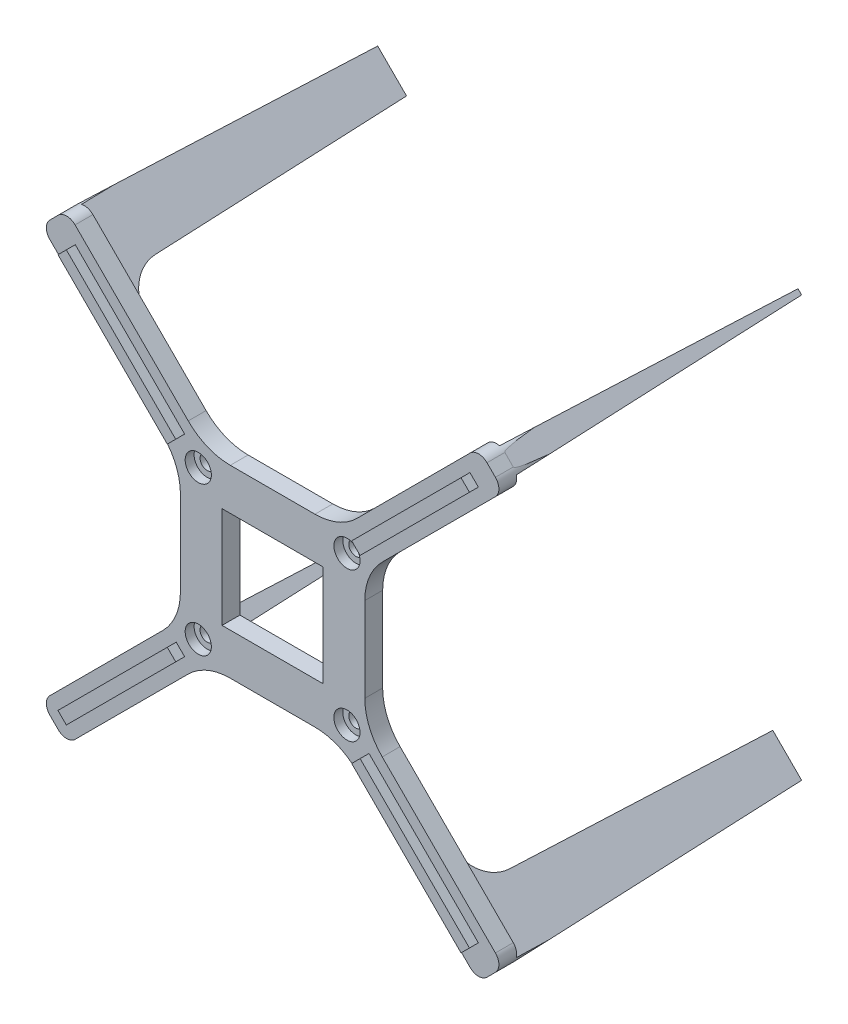
from build123d import *

# Parameters (mm, degrees)
SKETCH2_W                      = 17
SKETCH2_H                      = 17
BOSS_EXTRUDE1_DEPTH            = 3
SKETCH3_R                      = 2.2
CUT_EXTRUDE1_DEPTH             = 1.5
M2_CLEARANCE_HOLE1_D           = 2.4
M2_CLEARANCE_HOLE1_CSINK_D     = 2.45
M2_CLEARANCE_HOLE1_CSINK_ANGLE = 90
BOSS_EXTRUDE2_DEPTH            = 50
BOSS_EXTRUDE2_DRAFT            = 1.8
BOSS_EXTRUDE2_PROFILE_2_DEPTH  = 50
BOSS_EXTRUDE2_PROFILE_2_DRAFT  = 1.8
BOSS_EXTRUDE2_PROFILE_3_DEPTH  = 50
BOSS_EXTRUDE2_PROFILE_3_DRAFT  = 1.8
BOSS_EXTRUDE2_PROFILE_4_DEPTH  = 50
BOSS_EXTRUDE2_PROFILE_4_DRAFT  = 1.8
FILLET1_R                      = 6
FILLET2_R                      = 2
BOSS_EXTRUDE3_DEPTH            = 1.5


with BuildPart() as part:
    # Sketch2 → Boss-Extrude1 (new body)
    with BuildSketch(Plane(origin=(0, 0, 0), x_dir=(0, 1, 0), z_dir=(0, 0, 1))):
        with BuildLine():
            Line((-38.870057685, 34.627416998), (-34.627416998, 38.870057685))
            Line((-34.627416998, 38.870057685), (-14.186291501, 18.428932188))
            ThreePointArc((-14.186291501, 18.428932188), (-10.942058013, 16.261204675), (-7.115223689, 15.5))
            Line((-7.115223689, 15.5), (7.115223689, 15.5))
            ThreePointArc((7.115223689, 15.5), (10.942058013, 16.261204675), (14.186291501, 18.428932188))
            Line((14.186291501, 18.428932188), (34.627416998, 38.870057685))
            Line((34.627416998, 38.870057685), (38.870057685, 34.627416998))
            Line((38.870057685, 34.627416998), (18.428932188, 14.186291501))
            ThreePointArc((18.428932188, 14.186291501), (16.261204675, 10.942058013), (15.5, 7.115223689))
            Line((15.5, 7.115223689), (15.5, -7.115223689))
            ThreePointArc((15.5, -7.115223689), (16.261204675, -10.942058013), (18.428932188, -14.186291501))
            Line((18.428932188, -14.186291501), (38.870057685, -34.627416998))
            Line((38.870057685, -34.627416998), (34.627416998, -38.870057685))
            Line((34.627416998, -38.870057685), (14.186291501, -18.428932188))
            ThreePointArc((14.186291501, -18.428932188), (10.942058013, -16.261204675), (7.115223689, -15.5))
            Line((7.115223689, -15.5), (-7.115223689, -15.5))
            ThreePointArc((-7.115223689, -15.5), (-10.942058013, -16.261204675), (-14.186291501, -18.428932188))
            Line((-14.186291501, -18.428932188), (-34.627416998, -38.870057685))
            Line((-34.627416998, -38.870057685), (-38.870057685, -34.627416998))
            Line((-38.870057685, -34.627416998), (-18.428932188, -14.186291501))
            ThreePointArc((-18.428932188, -14.186291501), (-16.261204675, -10.942058013), (-15.5, -7.115223689))
            Line((-15.5, -7.115223689), (-15.5, 7.115223689))
            ThreePointArc((-15.5, 7.115223689), (-16.261204675, 10.942058013), (-18.428932188, 14.186291501))
            Line((-18.428932188, 14.186291501), (-38.870057685, 34.627416998))
        make_face()
        Rectangle(SKETCH2_W, SKETCH2_H, mode=Mode.SUBTRACT)
    extrude(amount=BOSS_EXTRUDE1_DEPTH)

    # Sketch3 → Cut-Extrude1 (cut)
    with BuildSketch(Plane.XY.offset(3)):
        with Locations((-12.5, 12.5)):
            Circle(SKETCH3_R)
        with Locations((12.5, 12.5)):
            Circle(SKETCH3_R)
        with Locations((12.5, -12.5)):
            Circle(SKETCH3_R)
        with Locations((-12.5, -12.5)):
            Circle(SKETCH3_R)
    extrude(amount=-CUT_EXTRUDE1_DEPTH, mode=Mode.SUBTRACT)

    # M2 Clearance Hole1 (through all)
    with Locations(Plane.XY.offset(3)):
        with Locations((12.5, 12.5), (-12.5, -12.5), (-12.5, 12.5), (12.5, -12.5)):
            CounterSinkHole(M2_CLEARANCE_HOLE1_D / 2, M2_CLEARANCE_HOLE1_CSINK_D / 2, counter_sink_angle=M2_CLEARANCE_HOLE1_CSINK_ANGLE)


with BuildPart() as boss_extrude2_tool:
    # Sketch7 → Boss-Extrude2 (with draft: the straight prism first)
    with BuildSketch(Plane(origin=(0, 0, 0), x_dir=(1, 0, 0), z_dir=(0, 0, -1))):
        Polygon((28.263455967, 31.091883092), (31.091883092, 28.263455967), (38.162950904, 35.334523779), (35.334523779, 38.162950904), align=None)
    extrude(amount=BOSS_EXTRUDE2_DEPTH)
    # Boss-Extrude2: the draft: its side faces are tilted about the plane it starts from
    boss_extrude2_sides = [boss_extrude2_tool.faces().sort_by_distance(p)[0] for p in [
        (29.67766953, -29.67766953, -25),
        (34.627416998, -31.798989873, -25),
        (36.748737342, -36.748737342, -25),
        (31.798989873, -34.627416998, -25),
    ]]
    draft(boss_extrude2_sides, Plane(origin=(0, 0, 0), x_dir=(1, 0, 0), z_dir=(0, 0, -1)), BOSS_EXTRUDE2_DRAFT)


with BuildPart() as part_1:
    add(part.part)

    # Boss-Extrude2: add boss_extrude2_tool
    add(boss_extrude2_tool.part)


with BuildPart() as boss_extrude2_profile_2_tool:
    # Sketch7 → Boss-Extrude2 profile 2 (with draft: the straight prism first)
    with BuildSketch(Plane(origin=(0, 0, 0), x_dir=(1, 0, 0), z_dir=(0, 0, -1))):
        Polygon((31.091883092, -28.263455967), (28.263455967, -31.091883092), (35.334523779, -38.162950904), (38.162950904, -35.334523779), align=None)
    extrude(amount=BOSS_EXTRUDE2_PROFILE_2_DEPTH)
    # Boss-Extrude2 profile 2: the draft: its side faces are tilted about the plane it starts from
    boss_extrude2_profile_2_sides = [boss_extrude2_profile_2_tool.faces().sort_by_distance(p)[0] for p in [
        (29.67766953, 29.67766953, -25),
        (31.798989873, 34.627416998, -25),
        (36.748737342, 36.748737342, -25),
        (34.627416998, 31.798989873, -25),
    ]]
    draft(boss_extrude2_profile_2_sides, Plane(origin=(0, 0, 0), x_dir=(1, 0, 0), z_dir=(0, 0, -1)), BOSS_EXTRUDE2_PROFILE_2_DRAFT)


with BuildPart() as part_2:
    add(part_1.part)

    # Boss-Extrude2 profile 2: add boss_extrude2_profile_2_tool
    add(boss_extrude2_profile_2_tool.part)


with BuildPart() as boss_extrude2_profile_3_tool:
    # Sketch7 → Boss-Extrude2 profile 3 (with draft: the straight prism first)
    with BuildSketch(Plane(origin=(0, 0, 0), x_dir=(1, 0, 0), z_dir=(0, 0, -1))):
        Polygon((-28.263455967, -31.091883092), (-31.091883092, -28.263455967), (-38.162950904, -35.334523779), (-35.334523779, -38.162950904), align=None)
    extrude(amount=BOSS_EXTRUDE2_PROFILE_3_DEPTH)
    # Boss-Extrude2 profile 3: the draft: its side faces are tilted about the plane it starts from
    boss_extrude2_profile_3_sides = [boss_extrude2_profile_3_tool.faces().sort_by_distance(p)[0] for p in [
        (-29.67766953, 29.67766953, -25),
        (-34.627416998, 31.798989873, -25),
        (-36.748737342, 36.748737342, -25),
        (-31.798989873, 34.627416998, -25),
    ]]
    draft(boss_extrude2_profile_3_sides, Plane(origin=(0, 0, 0), x_dir=(1, 0, 0), z_dir=(0, 0, -1)), BOSS_EXTRUDE2_PROFILE_3_DRAFT)


with BuildPart() as part_3:
    add(part_2.part)

    # Boss-Extrude2 profile 3: add boss_extrude2_profile_3_tool
    add(boss_extrude2_profile_3_tool.part)


with BuildPart() as boss_extrude2_profile_4_tool:
    # Sketch7 → Boss-Extrude2 profile 4 (with draft: the straight prism first)
    with BuildSketch(Plane(origin=(0, 0, 0), x_dir=(1, 0, 0), z_dir=(0, 0, -1))):
        Polygon((-31.091883092, 28.263455967), (-28.263455967, 31.091883092), (-35.334523779, 38.162950904), (-38.162950904, 35.334523779), align=None)
    extrude(amount=BOSS_EXTRUDE2_PROFILE_4_DEPTH)
    # Boss-Extrude2 profile 4: the draft: its side faces are tilted about the plane it starts from
    boss_extrude2_profile_4_sides = [boss_extrude2_profile_4_tool.faces().sort_by_distance(p)[0] for p in [
        (-29.67766953, -29.67766953, -25),
        (-31.798989873, -34.627416998, -25),
        (-36.748737342, -36.748737342, -25),
        (-34.627416998, -31.798989873, -25),
    ]]
    draft(boss_extrude2_profile_4_sides, Plane(origin=(0, 0, 0), x_dir=(1, 0, 0), z_dir=(0, 0, -1)), BOSS_EXTRUDE2_PROFILE_4_DRAFT)


with BuildPart() as part_4:
    add(part_3.part)

    # Boss-Extrude2 profile 4: add boss_extrude2_profile_4_tool
    add(boss_extrude2_profile_4_tool.part)

    # Fillet1
    fillet1_edges = [part_4.edges().sort_by_distance(p)[0] for p in [
        (-29.67766953, -29.67766953, 0),
        (-29.67766953, 29.67766953, 0),
        (29.67766953, 29.67766953, 0),
        (29.67766953, -29.67766953, 0),
    ]]
    fillet(fillet1_edges, radius=FILLET1_R)

    # Fillet2
    # the kernel refuses this fillet: 2 mm, written as the material it takes off along each edge
    with BuildSketch(Plane(origin=(34.627416998, 38.870057685, -12), x_dir=(0.7071067811865476, -0.7071067811865476, 0), z_dir=(0, 0, 1)), Plane(origin=(38.870057685, 34.627416998, -12), x_dir=(-0.7071067811865476, -0.7071067811865476, 0), z_dir=(0, 0, 1)), Plane(origin=(38.870057685, -34.627416998, -12), x_dir=(-0.7071067811865476, -0.7071067811865476, 0), z_dir=(0, 0, 1)), Plane(origin=(34.627416998, -38.870057685, -12), x_dir=(-0.7071067811865476, 0.7071067811865476, 0), z_dir=(0, 0, 1)), Plane(origin=(-38.870057685, -34.627416998, -12), x_dir=(0.7071067811865476, 0.7071067811865476, 0), z_dir=(0, 0, 1)), Plane(origin=(-38.870057685, 34.627416998, -12), x_dir=(0.7071067811865476, 0.7071067811865476, 0), z_dir=(0, 0, 1)), Plane(origin=(-34.627416998, 38.870057685, -12), x_dir=(0.7071067811865476, -0.7071067811865476, 0), z_dir=(0, 0, 1))) as fillet2_piece_1:
        with BuildLine():
            CenterArc((FILLET2_R, -FILLET2_R), FILLET2_R, 90, 90)
            Line((0, -FILLET2_R), (-FILLET2_R * 0.02, -FILLET2_R))
            Line((-FILLET2_R * 0.02, -FILLET2_R), (-FILLET2_R * 0.02, FILLET2_R * 0.02))
            Line((-FILLET2_R * 0.02, FILLET2_R * 0.02), (FILLET2_R, FILLET2_R * 0.02))
            Line((FILLET2_R, FILLET2_R * 0.02), (FILLET2_R, 0))
        make_face()
    extrude(amount=27, mode=Mode.SUBTRACT)
    with BuildSketch(Plane(origin=(-34.627416998, -38.870057685, -12), x_dir=(0.7071067811865458, 0.7071067811865493, 0), z_dir=(0, 0, 1))) as fillet2_piece_2:
        with BuildLine():
            CenterArc((FILLET2_R, FILLET2_R), FILLET2_R, 180, 90)
            Line((0, FILLET2_R), (-FILLET2_R * 0.02, FILLET2_R))
            Line((-FILLET2_R * 0.02, FILLET2_R), (-FILLET2_R * 0.02, -FILLET2_R * 0.02))
            Line((-FILLET2_R * 0.02, -FILLET2_R * 0.02), (FILLET2_R, -FILLET2_R * 0.02))
            Line((FILLET2_R, -FILLET2_R * 0.02), (FILLET2_R, 0))
        make_face()
    extrude(amount=27, mode=Mode.SUBTRACT)

    # Sketch8 → Boss-Extrude3 (add)
    with BuildSketch(Plane.XY.offset(3)):
        Polygon((-16.207106781, 14.792893219), (-14.792893219, 16.207106781), (-33.17766953, 34.591883092), (-34.591883092, 33.17766953), align=None)
        Polygon((14.792893219, 16.207106781), (16.207106781, 14.792893219), (34.591883092, 33.17766953), (33.17766953, 34.591883092), align=None)
        Polygon((16.207106781, -14.792893219), (14.792893219, -16.207106781), (33.17766953, -34.591883092), (34.591883092, -33.17766953), align=None)
        Polygon((-14.792893219, -16.207106781), (-16.207106781, -14.792893219), (-34.591883092, -33.17766953), (-33.17766953, -34.591883092), align=None)
    extrude(amount=BOSS_EXTRUDE3_DEPTH)


solid = part_4.part
